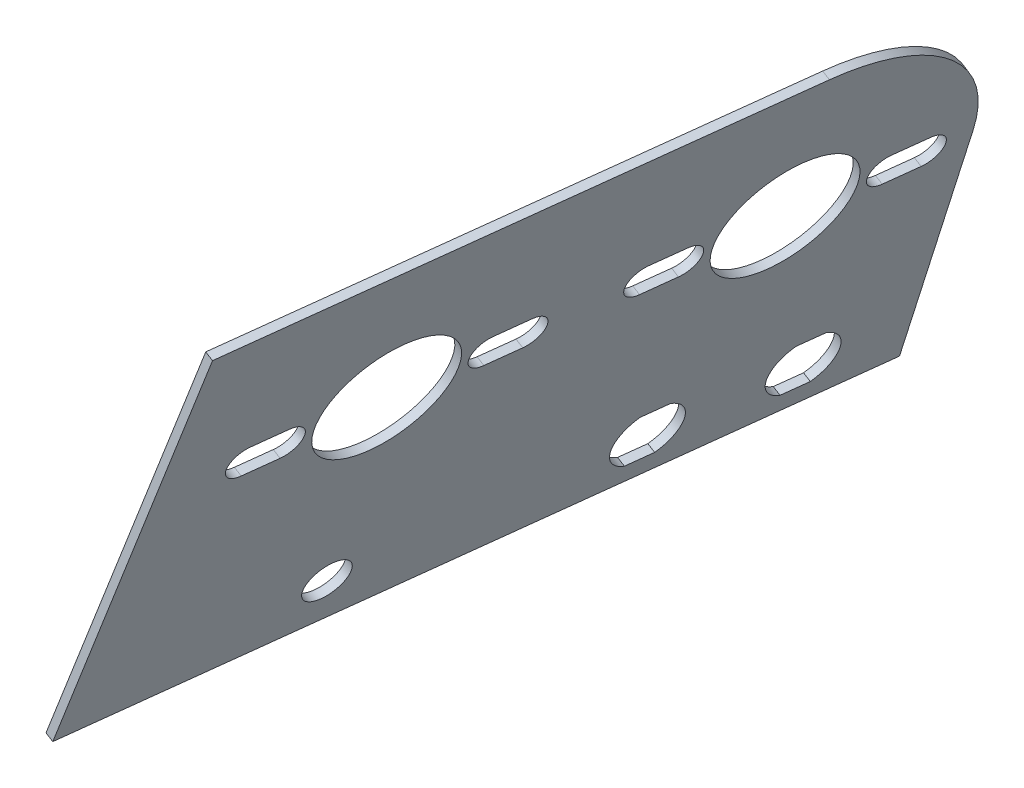
from build123d import *

# Parameters (mm, degrees)
SKETCH39_R          = 11.90625
SKETCH39_R_2        = 4.024999951
BOSS_EXTRUDE1_DEPTH = 1.5875


with BuildPart() as part:
    # Sketch39 → Boss-Extrude1 (new body)
    with BuildSketch(Plane(origin=(-441.521969452, 172.104793819, -62.182961286), x_dir=(-0.1212218165913434, 0.04725213510134498, 0.9915001295565519), z_dir=(-0.9237984742451071, 0.36009566214142513, -0.1301056996804562))):
        with BuildLine():
            Line((-228.044977909, 213.495528257), (-90.363815922, 201.963804234))
            Line((-90.363815922, 201.963804234), (-90.363815922, 283.724086083))
            Line((-90.363815922, 283.724086083), (-190.676741831, 292.125968815))
            ThreePointArc((-190.676741831, 292.125968815), (-213.041445426, 284.983204878), (-223.80498218, 264.11827449))
            Line((-223.80498218, 264.11827449), (-228.044977909, 213.495528257))
        make_face()
        with Locations((-128.463815922, 256.132810093)):
            Circle(SKETCH39_R, mode=Mode.SUBTRACT)
        with Locations((-193.237014843, 261.558001479)):
            Circle(SKETCH39_R, mode=Mode.SUBTRACT)
        with Locations((-131.908812452, 215.001828778)):
            Circle(SKETCH39_R_2, mode=Mode.SUBTRACT)
        with BuildLine():
            Line((-211.342041249, 227.174154397), (-206.415245302, 226.761502075))
            ThreePointArc((-206.415245302, 226.761502075), (-203.328738088, 220.983728264), (-207.333354614, 215.799883796))
            Line((-207.333354614, 215.799883796), (-212.260150561, 216.212536118))
            ThreePointArc((-212.260150561, 216.212536118), (-215.346657775, 221.990309928), (-211.342041249, 227.174154397))
        make_face(mode=Mode.SUBTRACT)
        with BuildLine():
            Line((-186.030668133, 225.054156527), (-181.103872186, 224.641504205))
            ThreePointArc((-181.103872186, 224.641504205), (-178.017364976, 218.8637304), (-182.021981496, 213.679885937))
            Line((-182.021981496, 213.679885937), (-186.948777443, 214.092538259))
            ThreePointArc((-186.948777443, 214.092538259), (-190.035284653, 219.870312063), (-186.030668133, 225.054156527))
        make_face(mode=Mode.SUBTRACT)
        with BuildLine():
            Line((-215.859429659, 266.728109418), (-209.53158638, 266.198109952))
            ThreePointArc((-209.53158638, 266.198109952), (-206.55149466, 262.673178781), (-210.076425831, 259.693087061))
            Line((-210.076425831, 259.693087061), (-216.40426911, 260.223086527))
            ThreePointArc((-216.40426911, 260.223086527), (-219.38436083, 263.748017698), (-215.859429659, 266.728109418))
        make_face(mode=Mode.SUBTRACT)
        with BuildLine():
            Line((-170.614600027, 256.387893539), (-176.942443306, 256.917893006))
            ThreePointArc((-176.942443306, 256.917893006), (-179.922535026, 260.442824177), (-176.397603855, 263.422915897))
            Line((-176.397603855, 263.422915897), (-170.069760576, 262.89291643))
            ThreePointArc((-170.069760576, 262.89291643), (-167.089668856, 259.367985259), (-170.614600027, 256.387893539))
        make_face(mode=Mode.SUBTRACT)
        with BuildLine():
            Line((-151.086230738, 261.302918032), (-144.758387459, 260.772918566))
            ThreePointArc((-144.758387459, 260.772918566), (-141.778295739, 257.247987395), (-145.30322691, 254.267895675))
            Line((-145.30322691, 254.267895675), (-151.631070189, 254.797895141))
            ThreePointArc((-151.631070189, 254.797895141), (-154.611161909, 258.322826312), (-151.086230738, 261.302918032))
        make_face(mode=Mode.SUBTRACT)
        with BuildLine():
            Line((-105.841401106, 250.962702154), (-112.169244385, 251.49270162))
            ThreePointArc((-112.169244385, 251.49270162), (-115.149336105, 255.017632791), (-111.624404934, 257.997724511))
            Line((-111.624404934, 257.997724511), (-105.296561655, 257.467725045))
            ThreePointArc((-105.296561655, 257.467725045), (-102.316469935, 253.942793873), (-105.841401106, 250.962702154))
        make_face(mode=Mode.SUBTRACT)
    extrude(amount=BOSS_EXTRUDE1_DEPTH)


solid = part.part
